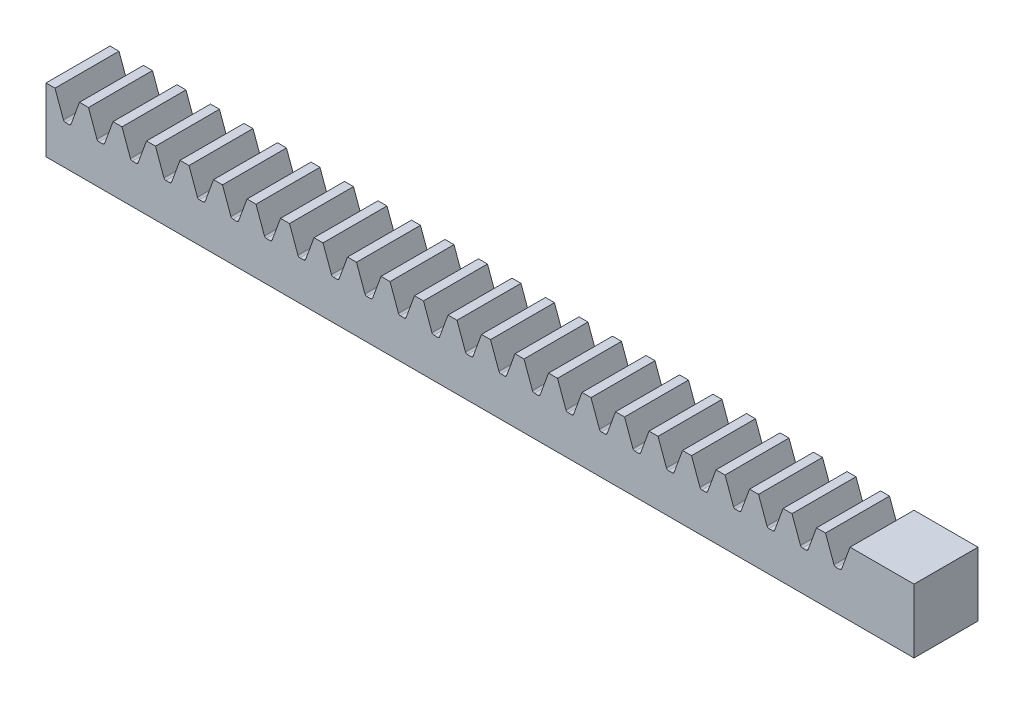
from build123d import *

# Parameters (mm, degrees)
BOSS_EXTRUDE1_DEPTH      = 152.4
BOSS_EXTRUDE1_DEPTH_BACK = 152.4
SKETCH3_W                = 3.175
SKETCH3_H                = 3.175
CUT_EXTRUDE1_DEPTH       = 153.416535561
FILLET1_R                = 0.099598028
LPATTERN1_START          = -1.5875
LPATTERN1_DEPTH          = 3.175
SKETCH7_W                = 122.08256
SKETCH7_H                = 3.175
SKETCH7_W_2              = 139.64412
CUT_EXTRUDE2_DEPTH       = 153.44133554


# Read off the part's stored shape, not the designer's step: LPattern1
with BuildPart() as part:
    # Sketch3 → Boss-Extrude1 (new, two sides: drawn at the far end of the back side and taken through both)
    with BuildSketch(Plane(origin=(0, 0, 0), x_dir=(0, 0, -1), z_dir=(1, 0, 0)).offset(-BOSS_EXTRUDE1_DEPTH_BACK)):
        Rectangle(SKETCH3_W, SKETCH3_H)
    extrude(amount=BOSS_EXTRUDE1_DEPTH + BOSS_EXTRUDE1_DEPTH_BACK)

    # Sketch4 → Cut-Extrude1 (cut, symmetric)
    with BuildSketch(Plane.XY):
        Polygon((-151.953986831, 1.5875), (-151.511775129, 0.372533333), (-151.179781702, 0.372533333), (-150.73757, 1.5875), align=None)
    extrude(amount=CUT_EXTRUDE1_DEPTH, both=True, mode=Mode.SUBTRACT)

    # Fillet1
    fillet1_edges = [part.edges().sort_by_distance(p)[0] for p in [
        (-151.179781702, 0.372533333, 0),
        (-151.511775129, 0.372533333, 0),
    ]]
    fillet(fillet1_edges, radius=FILLET1_R)

    # LPattern1 outline → LPattern1 (cut)
    with BuildSketch(Plane.XY.offset(LPATTERN1_START)):
        with BuildLine():
            ThreePointArc((-149.873197371, 0.43806683), (-149.836732921, 0.390545433), (-149.779605839, 0.372533333))
            Line((-149.779605839, 0.372533333), (-149.587090992, 0.372533333))
            ThreePointArc((-149.587090992, 0.372533333), (-149.52996391, 0.390545433), (-149.49349946, 0.43806683))
            Line((-149.49349946, 0.43806683), (-149.07514, 1.5875))
            Line((-149.07514, 1.5875), (-150.291556831, 1.5875))
            Line((-150.291556831, 1.5875), (-149.873197371, 0.43806683))
        make_face()
        with BuildLine():
            Line((27.14244, 1.5875), (25.926023169, 1.5875))
            Line((25.926023169, 1.5875), (26.344382629, 0.43806683))
            ThreePointArc((26.344382629, 0.43806683), (26.380847079, 0.390545433), (26.437974161, 0.372533333))
            Line((26.437974161, 0.372533333), (26.630489008, 0.372533333))
            ThreePointArc((26.630489008, 0.372533333), (26.68761609, 0.390545433), (26.72408054, 0.43806683))
            Line((26.72408054, 0.43806683), (27.14244, 1.5875))
        make_face()
        with BuildLine():
            Line((25.48001, 1.5875), (24.263593169, 1.5875))
            Line((24.263593169, 1.5875), (24.681952629, 0.43806683))
            ThreePointArc((24.681952629, 0.43806683), (24.718417079, 0.390545433), (24.775544161, 0.372533333))
            Line((24.775544161, 0.372533333), (24.968059008, 0.372533333))
            ThreePointArc((24.968059008, 0.372533333), (25.02518609, 0.390545433), (25.06165054, 0.43806683))
            Line((25.06165054, 0.43806683), (25.48001, 1.5875))
        make_face()
        with BuildLine():
            Line((23.81758, 1.5875), (22.601163169, 1.5875))
            Line((22.601163169, 1.5875), (23.019522629, 0.43806683))
            ThreePointArc((23.019522629, 0.43806683), (23.055987079, 0.390545433), (23.113114161, 0.372533333))
            Line((23.113114161, 0.372533333), (23.305629008, 0.372533333))
            ThreePointArc((23.305629008, 0.372533333), (23.36275609, 0.390545433), (23.39922054, 0.43806683))
            Line((23.39922054, 0.43806683), (23.81758, 1.5875))
        make_face()
        with BuildLine():
            Line((22.15515, 1.5875), (20.938733169, 1.5875))
            Line((20.938733169, 1.5875), (21.357092629, 0.43806683))
            ThreePointArc((21.357092629, 0.43806683), (21.393557079, 0.390545433), (21.450684161, 0.372533333))
            Line((21.450684161, 0.372533333), (21.643199008, 0.372533333))
            ThreePointArc((21.643199008, 0.372533333), (21.70032609, 0.390545433), (21.73679054, 0.43806683))
            Line((21.73679054, 0.43806683), (22.15515, 1.5875))
        make_face()
        with BuildLine():
            Line((20.49272, 1.5875), (19.276303169, 1.5875))
            Line((19.276303169, 1.5875), (19.694662629, 0.43806683))
            ThreePointArc((19.694662629, 0.43806683), (19.731127079, 0.390545433), (19.788254161, 0.372533333))
            Line((19.788254161, 0.372533333), (19.980769008, 0.372533333))
            ThreePointArc((19.980769008, 0.372533333), (20.03789609, 0.390545433), (20.07436054, 0.43806683))
            Line((20.07436054, 0.43806683), (20.49272, 1.5875))
        make_face()
        with BuildLine():
            Line((18.83029, 1.5875), (17.613873169, 1.5875))
            Line((17.613873169, 1.5875), (18.032232629, 0.43806683))
            ThreePointArc((18.032232629, 0.43806683), (18.068697079, 0.390545433), (18.125824161, 0.372533333))
            Line((18.125824161, 0.372533333), (18.318339008, 0.372533333))
            ThreePointArc((18.318339008, 0.372533333), (18.37546609, 0.390545433), (18.41193054, 0.43806683))
            Line((18.41193054, 0.43806683), (18.83029, 1.5875))
        make_face()
        with BuildLine():
            Line((17.16786, 1.5875), (15.951443169, 1.5875))
            Line((15.951443169, 1.5875), (16.369802629, 0.43806683))
            ThreePointArc((16.369802629, 0.43806683), (16.406267079, 0.390545433), (16.463394161, 0.372533333))
            Line((16.463394161, 0.372533333), (16.655909008, 0.372533333))
            ThreePointArc((16.655909008, 0.372533333), (16.71303609, 0.390545433), (16.74950054, 0.43806683))
            Line((16.74950054, 0.43806683), (17.16786, 1.5875))
        make_face()
        with BuildLine():
            Line((15.50543, 1.5875), (14.289013169, 1.5875))
            Line((14.289013169, 1.5875), (14.707372629, 0.43806683))
            ThreePointArc((14.707372629, 0.43806683), (14.743837079, 0.390545433), (14.800964161, 0.372533333))
            Line((14.800964161, 0.372533333), (14.993479008, 0.372533333))
            ThreePointArc((14.993479008, 0.372533333), (15.05060609, 0.390545433), (15.08707054, 0.43806683))
            Line((15.08707054, 0.43806683), (15.50543, 1.5875))
        make_face()
        with BuildLine():
            Line((13.843, 1.5875), (12.626583169, 1.5875))
            Line((12.626583169, 1.5875), (13.044942629, 0.43806683))
            ThreePointArc((13.044942629, 0.43806683), (13.081407079, 0.390545433), (13.138534161, 0.372533333))
            Line((13.138534161, 0.372533333), (13.331049008, 0.372533333))
            ThreePointArc((13.331049008, 0.372533333), (13.38817609, 0.390545433), (13.42464054, 0.43806683))
            Line((13.42464054, 0.43806683), (13.843, 1.5875))
        make_face()
        with BuildLine():
            Line((12.18057, 1.5875), (10.964153169, 1.5875))
            Line((10.964153169, 1.5875), (11.382512629, 0.43806683))
            ThreePointArc((11.382512629, 0.43806683), (11.418977079, 0.390545433), (11.476104161, 0.372533333))
            Line((11.476104161, 0.372533333), (11.668619008, 0.372533333))
            ThreePointArc((11.668619008, 0.372533333), (11.72574609, 0.390545433), (11.76221054, 0.43806683))
            Line((11.76221054, 0.43806683), (12.18057, 1.5875))
        make_face()
        with BuildLine():
            Line((10.51814, 1.5875), (9.301723169, 1.5875))
            Line((9.301723169, 1.5875), (9.720082629, 0.43806683))
            ThreePointArc((9.720082629, 0.43806683), (9.756547079, 0.390545433), (9.813674161, 0.372533333))
            Line((9.813674161, 0.372533333), (10.006189008, 0.372533333))
            ThreePointArc((10.006189008, 0.372533333), (10.06331609, 0.390545433), (10.09978054, 0.43806683))
            Line((10.09978054, 0.43806683), (10.51814, 1.5875))
        make_face()
        with BuildLine():
            Line((8.85571, 1.5875), (7.639293169, 1.5875))
            Line((7.639293169, 1.5875), (8.057652629, 0.43806683))
            ThreePointArc((8.057652629, 0.43806683), (8.094117079, 0.390545433), (8.151244161, 0.372533333))
            Line((8.151244161, 0.372533333), (8.343759008, 0.372533333))
            ThreePointArc((8.343759008, 0.372533333), (8.40088609, 0.390545433), (8.43735054, 0.43806683))
            Line((8.43735054, 0.43806683), (8.85571, 1.5875))
        make_face()
        with BuildLine():
            Line((7.19328, 1.5875), (5.976863169, 1.5875))
            Line((5.976863169, 1.5875), (6.395222629, 0.43806683))
            ThreePointArc((6.395222629, 0.43806683), (6.431687079, 0.390545433), (6.488814161, 0.372533333))
            Line((6.488814161, 0.372533333), (6.681329008, 0.372533333))
            ThreePointArc((6.681329008, 0.372533333), (6.73845609, 0.390545433), (6.77492054, 0.43806683))
            Line((6.77492054, 0.43806683), (7.19328, 1.5875))
        make_face()
        with BuildLine():
            Line((5.53085, 1.5875), (4.314433169, 1.5875))
            Line((4.314433169, 1.5875), (4.732792629, 0.43806683))
            ThreePointArc((4.732792629, 0.43806683), (4.769257079, 0.390545433), (4.826384161, 0.372533333))
            Line((4.826384161, 0.372533333), (5.018899008, 0.372533333))
            ThreePointArc((5.018899008, 0.372533333), (5.07602609, 0.390545433), (5.11249054, 0.43806683))
            Line((5.11249054, 0.43806683), (5.53085, 1.5875))
        make_face()
        with BuildLine():
            Line((3.86842, 1.5875), (2.652003169, 1.5875))
            Line((2.652003169, 1.5875), (3.070362629, 0.43806683))
            ThreePointArc((3.070362629, 0.43806683), (3.106827079, 0.390545433), (3.163954161, 0.372533333))
            Line((3.163954161, 0.372533333), (3.356469008, 0.372533333))
            ThreePointArc((3.356469008, 0.372533333), (3.41359609, 0.390545433), (3.45006054, 0.43806683))
            Line((3.45006054, 0.43806683), (3.86842, 1.5875))
        make_face()
        with BuildLine():
            Line((2.20599, 1.5875), (0.989573169, 1.5875))
            Line((0.989573169, 1.5875), (1.407932629, 0.43806683))
            ThreePointArc((1.407932629, 0.43806683), (1.444397079, 0.390545433), (1.501524161, 0.372533333))
            Line((1.501524161, 0.372533333), (1.694039008, 0.372533333))
            ThreePointArc((1.694039008, 0.372533333), (1.75116609, 0.390545433), (1.78763054, 0.43806683))
            Line((1.78763054, 0.43806683), (2.20599, 1.5875))
        make_face()
        with BuildLine():
            Line((0.54356, 1.5875), (-0.672856831, 1.5875))
            Line((-0.672856831, 1.5875), (-0.254497371, 0.43806683))
            ThreePointArc((-0.254497371, 0.43806683), (-0.218032921, 0.390545433), (-0.160905839, 0.372533333))
            Line((-0.160905839, 0.372533333), (0.031609008, 0.372533333))
            ThreePointArc((0.031609008, 0.372533333), (0.08873609, 0.390545433), (0.12520054, 0.43806683))
            Line((0.12520054, 0.43806683), (0.54356, 1.5875))
        make_face()
        with BuildLine():
            Line((-1.11887, 1.5875), (-2.335286831, 1.5875))
            Line((-2.335286831, 1.5875), (-1.916927371, 0.43806683))
            ThreePointArc((-1.916927371, 0.43806683), (-1.880462921, 0.390545433), (-1.823335839, 0.372533333))
            Line((-1.823335839, 0.372533333), (-1.630820992, 0.372533333))
            ThreePointArc((-1.630820992, 0.372533333), (-1.57369391, 0.390545433), (-1.53722946, 0.43806683))
            Line((-1.53722946, 0.43806683), (-1.11887, 1.5875))
        make_face()
        with BuildLine():
            Line((-2.7813, 1.5875), (-3.997716831, 1.5875))
            Line((-3.997716831, 1.5875), (-3.579357371, 0.43806683))
            ThreePointArc((-3.579357371, 0.43806683), (-3.542892921, 0.390545433), (-3.485765839, 0.372533333))
            Line((-3.485765839, 0.372533333), (-3.293250992, 0.372533333))
            ThreePointArc((-3.293250992, 0.372533333), (-3.23612391, 0.390545433), (-3.19965946, 0.43806683))
            Line((-3.19965946, 0.43806683), (-2.7813, 1.5875))
        make_face()
        with BuildLine():
            Line((-4.44373, 1.5875), (-5.660146831, 1.5875))
            Line((-5.660146831, 1.5875), (-5.241787371, 0.43806683))
            ThreePointArc((-5.241787371, 0.43806683), (-5.205322921, 0.390545433), (-5.148195839, 0.372533333))
            Line((-5.148195839, 0.372533333), (-4.955680992, 0.372533333))
            ThreePointArc((-4.955680992, 0.372533333), (-4.89855391, 0.390545433), (-4.86208946, 0.43806683))
            Line((-4.86208946, 0.43806683), (-4.44373, 1.5875))
        make_face()
        with BuildLine():
            Line((-6.10616, 1.5875), (-7.322576831, 1.5875))
            Line((-7.322576831, 1.5875), (-6.904217371, 0.43806683))
            ThreePointArc((-6.904217371, 0.43806683), (-6.867752921, 0.390545433), (-6.810625839, 0.372533333))
            Line((-6.810625839, 0.372533333), (-6.618110992, 0.372533333))
            ThreePointArc((-6.618110992, 0.372533333), (-6.56098391, 0.390545433), (-6.52451946, 0.43806683))
            Line((-6.52451946, 0.43806683), (-6.10616, 1.5875))
        make_face()
        with BuildLine():
            Line((-7.76859, 1.5875), (-8.985006831, 1.5875))
            Line((-8.985006831, 1.5875), (-8.566647371, 0.43806683))
            ThreePointArc((-8.566647371, 0.43806683), (-8.530182921, 0.390545433), (-8.473055839, 0.372533333))
            Line((-8.473055839, 0.372533333), (-8.280540992, 0.372533333))
            ThreePointArc((-8.280540992, 0.372533333), (-8.22341391, 0.390545433), (-8.18694946, 0.43806683))
            Line((-8.18694946, 0.43806683), (-7.76859, 1.5875))
        make_face()
        with BuildLine():
            Line((-9.43102, 1.5875), (-10.647436831, 1.5875))
            Line((-10.647436831, 1.5875), (-10.229077371, 0.43806683))
            ThreePointArc((-10.229077371, 0.43806683), (-10.192612921, 0.390545433), (-10.135485839, 0.372533333))
            Line((-10.135485839, 0.372533333), (-9.942970992, 0.372533333))
            ThreePointArc((-9.942970992, 0.372533333), (-9.88584391, 0.390545433), (-9.84937946, 0.43806683))
            Line((-9.84937946, 0.43806683), (-9.43102, 1.5875))
        make_face()
        with BuildLine():
            Line((-11.09345, 1.5875), (-12.309866831, 1.5875))
            Line((-12.309866831, 1.5875), (-11.891507371, 0.43806683))
            ThreePointArc((-11.891507371, 0.43806683), (-11.855042921, 0.390545433), (-11.797915839, 0.372533333))
            Line((-11.797915839, 0.372533333), (-11.605400992, 0.372533333))
            ThreePointArc((-11.605400992, 0.372533333), (-11.54827391, 0.390545433), (-11.51180946, 0.43806683))
            Line((-11.51180946, 0.43806683), (-11.09345, 1.5875))
        make_face()
        with BuildLine():
            Line((-12.75588, 1.5875), (-13.972296831, 1.5875))
            Line((-13.972296831, 1.5875), (-13.553937371, 0.43806683))
            ThreePointArc((-13.553937371, 0.43806683), (-13.517472921, 0.390545433), (-13.460345839, 0.372533333))
            Line((-13.460345839, 0.372533333), (-13.267830992, 0.372533333))
            ThreePointArc((-13.267830992, 0.372533333), (-13.21070391, 0.390545433), (-13.17423946, 0.43806683))
            Line((-13.17423946, 0.43806683), (-12.75588, 1.5875))
        make_face()
        with BuildLine():
            Line((-14.41831, 1.5875), (-15.634726831, 1.5875))
            Line((-15.634726831, 1.5875), (-15.216367371, 0.43806683))
            ThreePointArc((-15.216367371, 0.43806683), (-15.179902921, 0.390545433), (-15.122775839, 0.372533333))
            Line((-15.122775839, 0.372533333), (-14.930260992, 0.372533333))
            ThreePointArc((-14.930260992, 0.372533333), (-14.87313391, 0.390545433), (-14.83666946, 0.43806683))
            Line((-14.83666946, 0.43806683), (-14.41831, 1.5875))
        make_face()
        with BuildLine():
            Line((-16.08074, 1.5875), (-17.297156831, 1.5875))
            Line((-17.297156831, 1.5875), (-16.878797371, 0.43806683))
            ThreePointArc((-16.878797371, 0.43806683), (-16.842332921, 0.390545433), (-16.785205839, 0.372533333))
            Line((-16.785205839, 0.372533333), (-16.592690992, 0.372533333))
            ThreePointArc((-16.592690992, 0.372533333), (-16.53556391, 0.390545433), (-16.49909946, 0.43806683))
            Line((-16.49909946, 0.43806683), (-16.08074, 1.5875))
        make_face()
        with BuildLine():
            Line((-17.74317, 1.5875), (-18.959586831, 1.5875))
            Line((-18.959586831, 1.5875), (-18.541227371, 0.43806683))
            ThreePointArc((-18.541227371, 0.43806683), (-18.504762921, 0.390545433), (-18.447635839, 0.372533333))
            Line((-18.447635839, 0.372533333), (-18.255120992, 0.372533333))
            ThreePointArc((-18.255120992, 0.372533333), (-18.19799391, 0.390545433), (-18.16152946, 0.43806683))
            Line((-18.16152946, 0.43806683), (-17.74317, 1.5875))
        make_face()
        with BuildLine():
            Line((-19.4056, 1.5875), (-20.622016831, 1.5875))
            Line((-20.622016831, 1.5875), (-20.203657371, 0.43806683))
            ThreePointArc((-20.203657371, 0.43806683), (-20.167192921, 0.390545433), (-20.110065839, 0.372533333))
            Line((-20.110065839, 0.372533333), (-19.917550992, 0.372533333))
            ThreePointArc((-19.917550992, 0.372533333), (-19.86042391, 0.390545433), (-19.82395946, 0.43806683))
            Line((-19.82395946, 0.43806683), (-19.4056, 1.5875))
        make_face()
        with BuildLine():
            Line((-21.06803, 1.5875), (-22.284446831, 1.5875))
            Line((-22.284446831, 1.5875), (-21.866087371, 0.43806683))
            ThreePointArc((-21.866087371, 0.43806683), (-21.829622921, 0.390545433), (-21.772495839, 0.372533333))
            Line((-21.772495839, 0.372533333), (-21.579980992, 0.372533333))
            ThreePointArc((-21.579980992, 0.372533333), (-21.52285391, 0.390545433), (-21.48638946, 0.43806683))
            Line((-21.48638946, 0.43806683), (-21.06803, 1.5875))
        make_face()
        with BuildLine():
            Line((-22.73046, 1.5875), (-23.946876831, 1.5875))
            Line((-23.946876831, 1.5875), (-23.528517371, 0.43806683))
            ThreePointArc((-23.528517371, 0.43806683), (-23.492052921, 0.390545433), (-23.434925839, 0.372533333))
            Line((-23.434925839, 0.372533333), (-23.242410992, 0.372533333))
            ThreePointArc((-23.242410992, 0.372533333), (-23.18528391, 0.390545433), (-23.14881946, 0.43806683))
            Line((-23.14881946, 0.43806683), (-22.73046, 1.5875))
        make_face()
        with BuildLine():
            Line((-24.39289, 1.5875), (-25.609306831, 1.5875))
            Line((-25.609306831, 1.5875), (-25.190947371, 0.43806683))
            ThreePointArc((-25.190947371, 0.43806683), (-25.154482921, 0.390545433), (-25.097355839, 0.372533333))
            Line((-25.097355839, 0.372533333), (-24.904840992, 0.372533333))
            ThreePointArc((-24.904840992, 0.372533333), (-24.84771391, 0.390545433), (-24.81124946, 0.43806683))
            Line((-24.81124946, 0.43806683), (-24.39289, 1.5875))
        make_face()
        with BuildLine():
            Line((-26.05532, 1.5875), (-27.271736831, 1.5875))
            Line((-27.271736831, 1.5875), (-26.853377371, 0.43806683))
            ThreePointArc((-26.853377371, 0.43806683), (-26.816912921, 0.390545433), (-26.759785839, 0.372533333))
            Line((-26.759785839, 0.372533333), (-26.567270992, 0.372533333))
            ThreePointArc((-26.567270992, 0.372533333), (-26.51014391, 0.390545433), (-26.47367946, 0.43806683))
            Line((-26.47367946, 0.43806683), (-26.05532, 1.5875))
        make_face()
        with BuildLine():
            Line((-27.71775, 1.5875), (-28.934166831, 1.5875))
            Line((-28.934166831, 1.5875), (-28.515807371, 0.43806683))
            ThreePointArc((-28.515807371, 0.43806683), (-28.479342921, 0.390545433), (-28.422215839, 0.372533333))
            Line((-28.422215839, 0.372533333), (-28.229700992, 0.372533333))
            ThreePointArc((-28.229700992, 0.372533333), (-28.17257391, 0.390545433), (-28.13610946, 0.43806683))
            Line((-28.13610946, 0.43806683), (-27.71775, 1.5875))
        make_face()
        with BuildLine():
            Line((-29.38018, 1.5875), (-30.596596831, 1.5875))
            Line((-30.596596831, 1.5875), (-30.178237371, 0.43806683))
            ThreePointArc((-30.178237371, 0.43806683), (-30.141772921, 0.390545433), (-30.084645839, 0.372533333))
            Line((-30.084645839, 0.372533333), (-29.892130992, 0.372533333))
            ThreePointArc((-29.892130992, 0.372533333), (-29.83500391, 0.390545433), (-29.79853946, 0.43806683))
            Line((-29.79853946, 0.43806683), (-29.38018, 1.5875))
        make_face()
        with BuildLine():
            Line((-31.04261, 1.5875), (-32.259026831, 1.5875))
            Line((-32.259026831, 1.5875), (-31.840667371, 0.43806683))
            ThreePointArc((-31.840667371, 0.43806683), (-31.804202921, 0.390545433), (-31.747075839, 0.372533333))
            Line((-31.747075839, 0.372533333), (-31.554560992, 0.372533333))
            ThreePointArc((-31.554560992, 0.372533333), (-31.49743391, 0.390545433), (-31.46096946, 0.43806683))
            Line((-31.46096946, 0.43806683), (-31.04261, 1.5875))
        make_face()
        with BuildLine():
            Line((-32.70504, 1.5875), (-33.921456831, 1.5875))
            Line((-33.921456831, 1.5875), (-33.503097371, 0.43806683))
            ThreePointArc((-33.503097371, 0.43806683), (-33.466632921, 0.390545433), (-33.409505839, 0.372533333))
            Line((-33.409505839, 0.372533333), (-33.216990992, 0.372533333))
            ThreePointArc((-33.216990992, 0.372533333), (-33.15986391, 0.390545433), (-33.12339946, 0.43806683))
            Line((-33.12339946, 0.43806683), (-32.70504, 1.5875))
        make_face()
        with BuildLine():
            Line((-34.36747, 1.5875), (-35.583886831, 1.5875))
            Line((-35.583886831, 1.5875), (-35.165527371, 0.43806683))
            ThreePointArc((-35.165527371, 0.43806683), (-35.129062921, 0.390545433), (-35.071935839, 0.372533333))
            Line((-35.071935839, 0.372533333), (-34.879420992, 0.372533333))
            ThreePointArc((-34.879420992, 0.372533333), (-34.82229391, 0.390545433), (-34.78582946, 0.43806683))
            Line((-34.78582946, 0.43806683), (-34.36747, 1.5875))
        make_face()
        with BuildLine():
            Line((-36.0299, 1.5875), (-37.246316831, 1.5875))
            Line((-37.246316831, 1.5875), (-36.827957371, 0.43806683))
            ThreePointArc((-36.827957371, 0.43806683), (-36.791492921, 0.390545433), (-36.734365839, 0.372533333))
            Line((-36.734365839, 0.372533333), (-36.541850992, 0.372533333))
            ThreePointArc((-36.541850992, 0.372533333), (-36.48472391, 0.390545433), (-36.44825946, 0.43806683))
            Line((-36.44825946, 0.43806683), (-36.0299, 1.5875))
        make_face()
        with BuildLine():
            Line((-37.69233, 1.5875), (-38.908746831, 1.5875))
            Line((-38.908746831, 1.5875), (-38.490387371, 0.43806683))
            ThreePointArc((-38.490387371, 0.43806683), (-38.453922921, 0.390545433), (-38.396795839, 0.372533333))
            Line((-38.396795839, 0.372533333), (-38.204280992, 0.372533333))
            ThreePointArc((-38.204280992, 0.372533333), (-38.14715391, 0.390545433), (-38.11068946, 0.43806683))
            Line((-38.11068946, 0.43806683), (-37.69233, 1.5875))
        make_face()
        with BuildLine():
            Line((-39.35476, 1.5875), (-40.571176831, 1.5875))
            Line((-40.571176831, 1.5875), (-40.152817371, 0.43806683))
            ThreePointArc((-40.152817371, 0.43806683), (-40.116352921, 0.390545433), (-40.059225839, 0.372533333))
            Line((-40.059225839, 0.372533333), (-39.866710992, 0.372533333))
            ThreePointArc((-39.866710992, 0.372533333), (-39.80958391, 0.390545433), (-39.77311946, 0.43806683))
            Line((-39.77311946, 0.43806683), (-39.35476, 1.5875))
        make_face()
        with BuildLine():
            Line((-41.01719, 1.5875), (-42.233606831, 1.5875))
            Line((-42.233606831, 1.5875), (-41.815247371, 0.43806683))
            ThreePointArc((-41.815247371, 0.43806683), (-41.778782921, 0.390545433), (-41.721655839, 0.372533333))
            Line((-41.721655839, 0.372533333), (-41.529140992, 0.372533333))
            ThreePointArc((-41.529140992, 0.372533333), (-41.47201391, 0.390545433), (-41.43554946, 0.43806683))
            Line((-41.43554946, 0.43806683), (-41.01719, 1.5875))
        make_face()
        with BuildLine():
            Line((-42.67962, 1.5875), (-43.896036831, 1.5875))
            Line((-43.896036831, 1.5875), (-43.477677371, 0.43806683))
            ThreePointArc((-43.477677371, 0.43806683), (-43.441212921, 0.390545433), (-43.384085839, 0.372533333))
            Line((-43.384085839, 0.372533333), (-43.191570992, 0.372533333))
            ThreePointArc((-43.191570992, 0.372533333), (-43.13444391, 0.390545433), (-43.09797946, 0.43806683))
            Line((-43.09797946, 0.43806683), (-42.67962, 1.5875))
        make_face()
        with BuildLine():
            Line((-44.34205, 1.5875), (-45.558466831, 1.5875))
            Line((-45.558466831, 1.5875), (-45.140107371, 0.43806683))
            ThreePointArc((-45.140107371, 0.43806683), (-45.103642921, 0.390545433), (-45.046515839, 0.372533333))
            Line((-45.046515839, 0.372533333), (-44.854000992, 0.372533333))
            ThreePointArc((-44.854000992, 0.372533333), (-44.79687391, 0.390545433), (-44.76040946, 0.43806683))
            Line((-44.76040946, 0.43806683), (-44.34205, 1.5875))
        make_face()
        with BuildLine():
            Line((-46.00448, 1.5875), (-47.220896831, 1.5875))
            Line((-47.220896831, 1.5875), (-46.802537371, 0.43806683))
            ThreePointArc((-46.802537371, 0.43806683), (-46.766072921, 0.390545433), (-46.708945839, 0.372533333))
            Line((-46.708945839, 0.372533333), (-46.516430992, 0.372533333))
            ThreePointArc((-46.516430992, 0.372533333), (-46.45930391, 0.390545433), (-46.42283946, 0.43806683))
            Line((-46.42283946, 0.43806683), (-46.00448, 1.5875))
        make_face()
        with BuildLine():
            Line((-47.66691, 1.5875), (-48.883326831, 1.5875))
            Line((-48.883326831, 1.5875), (-48.464967371, 0.43806683))
            ThreePointArc((-48.464967371, 0.43806683), (-48.428502921, 0.390545433), (-48.371375839, 0.372533333))
            Line((-48.371375839, 0.372533333), (-48.178860992, 0.372533333))
            ThreePointArc((-48.178860992, 0.372533333), (-48.12173391, 0.390545433), (-48.08526946, 0.43806683))
            Line((-48.08526946, 0.43806683), (-47.66691, 1.5875))
        make_face()
        with BuildLine():
            Line((-49.32934, 1.5875), (-50.545756831, 1.5875))
            Line((-50.545756831, 1.5875), (-50.127397371, 0.43806683))
            ThreePointArc((-50.127397371, 0.43806683), (-50.090932921, 0.390545433), (-50.033805839, 0.372533333))
            Line((-50.033805839, 0.372533333), (-49.841290992, 0.372533333))
            ThreePointArc((-49.841290992, 0.372533333), (-49.78416391, 0.390545433), (-49.74769946, 0.43806683))
            Line((-49.74769946, 0.43806683), (-49.32934, 1.5875))
        make_face()
        with BuildLine():
            Line((-50.99177, 1.5875), (-52.208186831, 1.5875))
            Line((-52.208186831, 1.5875), (-51.789827371, 0.43806683))
            ThreePointArc((-51.789827371, 0.43806683), (-51.753362921, 0.390545433), (-51.696235839, 0.372533333))
            Line((-51.696235839, 0.372533333), (-51.503720992, 0.372533333))
            ThreePointArc((-51.503720992, 0.372533333), (-51.44659391, 0.390545433), (-51.41012946, 0.43806683))
            Line((-51.41012946, 0.43806683), (-50.99177, 1.5875))
        make_face()
        with BuildLine():
            Line((-52.6542, 1.5875), (-53.870616831, 1.5875))
            Line((-53.870616831, 1.5875), (-53.452257371, 0.43806683))
            ThreePointArc((-53.452257371, 0.43806683), (-53.415792921, 0.390545433), (-53.358665839, 0.372533333))
            Line((-53.358665839, 0.372533333), (-53.166150992, 0.372533333))
            ThreePointArc((-53.166150992, 0.372533333), (-53.10902391, 0.390545433), (-53.07255946, 0.43806683))
            Line((-53.07255946, 0.43806683), (-52.6542, 1.5875))
        make_face()
        with BuildLine():
            Line((-54.31663, 1.5875), (-55.533046831, 1.5875))
            Line((-55.533046831, 1.5875), (-55.114687371, 0.43806683))
            ThreePointArc((-55.114687371, 0.43806683), (-55.078222921, 0.390545433), (-55.021095839, 0.372533333))
            Line((-55.021095839, 0.372533333), (-54.828580992, 0.372533333))
            ThreePointArc((-54.828580992, 0.372533333), (-54.77145391, 0.390545433), (-54.73498946, 0.43806683))
            Line((-54.73498946, 0.43806683), (-54.31663, 1.5875))
        make_face()
        with BuildLine():
            Line((-55.97906, 1.5875), (-57.195476831, 1.5875))
            Line((-57.195476831, 1.5875), (-56.777117371, 0.43806683))
            ThreePointArc((-56.777117371, 0.43806683), (-56.740652921, 0.390545433), (-56.683525839, 0.372533333))
            Line((-56.683525839, 0.372533333), (-56.491010992, 0.372533333))
            ThreePointArc((-56.491010992, 0.372533333), (-56.43388391, 0.390545433), (-56.39741946, 0.43806683))
            Line((-56.39741946, 0.43806683), (-55.97906, 1.5875))
        make_face()
        with BuildLine():
            Line((-57.64149, 1.5875), (-58.857906831, 1.5875))
            Line((-58.857906831, 1.5875), (-58.439547371, 0.43806683))
            ThreePointArc((-58.439547371, 0.43806683), (-58.403082921, 0.390545433), (-58.345955839, 0.372533333))
            Line((-58.345955839, 0.372533333), (-58.153440992, 0.372533333))
            ThreePointArc((-58.153440992, 0.372533333), (-58.09631391, 0.390545433), (-58.05984946, 0.43806683))
            Line((-58.05984946, 0.43806683), (-57.64149, 1.5875))
        make_face()
        with BuildLine():
            Line((-59.30392, 1.5875), (-60.520336831, 1.5875))
            Line((-60.520336831, 1.5875), (-60.101977371, 0.43806683))
            ThreePointArc((-60.101977371, 0.43806683), (-60.065512921, 0.390545433), (-60.008385839, 0.372533333))
            Line((-60.008385839, 0.372533333), (-59.815870992, 0.372533333))
            ThreePointArc((-59.815870992, 0.372533333), (-59.75874391, 0.390545433), (-59.72227946, 0.43806683))
            Line((-59.72227946, 0.43806683), (-59.30392, 1.5875))
        make_face()
        with BuildLine():
            Line((-60.96635, 1.5875), (-62.182766831, 1.5875))
            Line((-62.182766831, 1.5875), (-61.764407371, 0.43806683))
            ThreePointArc((-61.764407371, 0.43806683), (-61.727942921, 0.390545433), (-61.670815839, 0.372533333))
            Line((-61.670815839, 0.372533333), (-61.478300992, 0.372533333))
            ThreePointArc((-61.478300992, 0.372533333), (-61.42117391, 0.390545433), (-61.38470946, 0.43806683))
            Line((-61.38470946, 0.43806683), (-60.96635, 1.5875))
        make_face()
        with BuildLine():
            Line((-62.62878, 1.5875), (-63.845196831, 1.5875))
            Line((-63.845196831, 1.5875), (-63.426837371, 0.43806683))
            ThreePointArc((-63.426837371, 0.43806683), (-63.390372921, 0.390545433), (-63.333245839, 0.372533333))
            Line((-63.333245839, 0.372533333), (-63.140730992, 0.372533333))
            ThreePointArc((-63.140730992, 0.372533333), (-63.08360391, 0.390545433), (-63.04713946, 0.43806683))
            Line((-63.04713946, 0.43806683), (-62.62878, 1.5875))
        make_face()
        with BuildLine():
            Line((-64.29121, 1.5875), (-65.507626831, 1.5875))
            Line((-65.507626831, 1.5875), (-65.089267371, 0.43806683))
            ThreePointArc((-65.089267371, 0.43806683), (-65.052802921, 0.390545433), (-64.995675839, 0.372533333))
            Line((-64.995675839, 0.372533333), (-64.803160992, 0.372533333))
            ThreePointArc((-64.803160992, 0.372533333), (-64.74603391, 0.390545433), (-64.70956946, 0.43806683))
            Line((-64.70956946, 0.43806683), (-64.29121, 1.5875))
        make_face()
        with BuildLine():
            Line((-65.95364, 1.5875), (-67.170056831, 1.5875))
            Line((-67.170056831, 1.5875), (-66.751697371, 0.43806683))
            ThreePointArc((-66.751697371, 0.43806683), (-66.715232921, 0.390545433), (-66.658105839, 0.372533333))
            Line((-66.658105839, 0.372533333), (-66.465590992, 0.372533333))
            ThreePointArc((-66.465590992, 0.372533333), (-66.40846391, 0.390545433), (-66.37199946, 0.43806683))
            Line((-66.37199946, 0.43806683), (-65.95364, 1.5875))
        make_face()
        with BuildLine():
            Line((-67.61607, 1.5875), (-68.832486831, 1.5875))
            Line((-68.832486831, 1.5875), (-68.414127371, 0.43806683))
            ThreePointArc((-68.414127371, 0.43806683), (-68.377662921, 0.390545433), (-68.320535839, 0.372533333))
            Line((-68.320535839, 0.372533333), (-68.128020992, 0.372533333))
            ThreePointArc((-68.128020992, 0.372533333), (-68.07089391, 0.390545433), (-68.03442946, 0.43806683))
            Line((-68.03442946, 0.43806683), (-67.61607, 1.5875))
        make_face()
        with BuildLine():
            Line((-69.2785, 1.5875), (-70.494916831, 1.5875))
            Line((-70.494916831, 1.5875), (-70.076557371, 0.43806683))
            ThreePointArc((-70.076557371, 0.43806683), (-70.040092921, 0.390545433), (-69.982965839, 0.372533333))
            Line((-69.982965839, 0.372533333), (-69.790450992, 0.372533333))
            ThreePointArc((-69.790450992, 0.372533333), (-69.73332391, 0.390545433), (-69.69685946, 0.43806683))
            Line((-69.69685946, 0.43806683), (-69.2785, 1.5875))
        make_face()
        with BuildLine():
            Line((-70.94093, 1.5875), (-72.157346831, 1.5875))
            Line((-72.157346831, 1.5875), (-71.738987371, 0.43806683))
            ThreePointArc((-71.738987371, 0.43806683), (-71.702522921, 0.390545433), (-71.645395839, 0.372533333))
            Line((-71.645395839, 0.372533333), (-71.452880992, 0.372533333))
            ThreePointArc((-71.452880992, 0.372533333), (-71.39575391, 0.390545433), (-71.35928946, 0.43806683))
            Line((-71.35928946, 0.43806683), (-70.94093, 1.5875))
        make_face()
        with BuildLine():
            Line((-72.60336, 1.5875), (-73.819776831, 1.5875))
            Line((-73.819776831, 1.5875), (-73.401417371, 0.43806683))
            ThreePointArc((-73.401417371, 0.43806683), (-73.364952921, 0.390545433), (-73.307825839, 0.372533333))
            Line((-73.307825839, 0.372533333), (-73.115310992, 0.372533333))
            ThreePointArc((-73.115310992, 0.372533333), (-73.05818391, 0.390545433), (-73.02171946, 0.43806683))
            Line((-73.02171946, 0.43806683), (-72.60336, 1.5875))
        make_face()
        with BuildLine():
            Line((-74.26579, 1.5875), (-75.482206831, 1.5875))
            Line((-75.482206831, 1.5875), (-75.063847371, 0.43806683))
            ThreePointArc((-75.063847371, 0.43806683), (-75.027382921, 0.390545433), (-74.970255839, 0.372533333))
            Line((-74.970255839, 0.372533333), (-74.777740992, 0.372533333))
            ThreePointArc((-74.777740992, 0.372533333), (-74.72061391, 0.390545433), (-74.68414946, 0.43806683))
            Line((-74.68414946, 0.43806683), (-74.26579, 1.5875))
        make_face()
        with BuildLine():
            Line((-75.92822, 1.5875), (-77.144636831, 1.5875))
            Line((-77.144636831, 1.5875), (-76.726277371, 0.43806683))
            ThreePointArc((-76.726277371, 0.43806683), (-76.689812921, 0.390545433), (-76.632685839, 0.372533333))
            Line((-76.632685839, 0.372533333), (-76.440170992, 0.372533333))
            ThreePointArc((-76.440170992, 0.372533333), (-76.38304391, 0.390545433), (-76.34657946, 0.43806683))
            Line((-76.34657946, 0.43806683), (-75.92822, 1.5875))
        make_face()
        with BuildLine():
            Line((-77.59065, 1.5875), (-78.807066831, 1.5875))
            Line((-78.807066831, 1.5875), (-78.388707371, 0.43806683))
            ThreePointArc((-78.388707371, 0.43806683), (-78.352242921, 0.390545433), (-78.295115839, 0.372533333))
            Line((-78.295115839, 0.372533333), (-78.102600992, 0.372533333))
            ThreePointArc((-78.102600992, 0.372533333), (-78.04547391, 0.390545433), (-78.00900946, 0.43806683))
            Line((-78.00900946, 0.43806683), (-77.59065, 1.5875))
        make_face()
        with BuildLine():
            Line((-79.25308, 1.5875), (-80.469496831, 1.5875))
            Line((-80.469496831, 1.5875), (-80.051137371, 0.43806683))
            ThreePointArc((-80.051137371, 0.43806683), (-80.014672921, 0.390545433), (-79.957545839, 0.372533333))
            Line((-79.957545839, 0.372533333), (-79.765030992, 0.372533333))
            ThreePointArc((-79.765030992, 0.372533333), (-79.70790391, 0.390545433), (-79.67143946, 0.43806683))
            Line((-79.67143946, 0.43806683), (-79.25308, 1.5875))
        make_face()
        with BuildLine():
            Line((-80.91551, 1.5875), (-82.131926831, 1.5875))
            Line((-82.131926831, 1.5875), (-81.713567371, 0.43806683))
            ThreePointArc((-81.713567371, 0.43806683), (-81.677102921, 0.390545433), (-81.619975839, 0.372533333))
            Line((-81.619975839, 0.372533333), (-81.427460992, 0.372533333))
            ThreePointArc((-81.427460992, 0.372533333), (-81.37033391, 0.390545433), (-81.33386946, 0.43806683))
            Line((-81.33386946, 0.43806683), (-80.91551, 1.5875))
        make_face()
        with BuildLine():
            Line((-82.57794, 1.5875), (-83.794356831, 1.5875))
            Line((-83.794356831, 1.5875), (-83.375997371, 0.43806683))
            ThreePointArc((-83.375997371, 0.43806683), (-83.339532921, 0.390545433), (-83.282405839, 0.372533333))
            Line((-83.282405839, 0.372533333), (-83.089890992, 0.372533333))
            ThreePointArc((-83.089890992, 0.372533333), (-83.03276391, 0.390545433), (-82.99629946, 0.43806683))
            Line((-82.99629946, 0.43806683), (-82.57794, 1.5875))
        make_face()
        with BuildLine():
            Line((-84.24037, 1.5875), (-85.456786831, 1.5875))
            Line((-85.456786831, 1.5875), (-85.038427371, 0.43806683))
            ThreePointArc((-85.038427371, 0.43806683), (-85.001962921, 0.390545433), (-84.944835839, 0.372533333))
            Line((-84.944835839, 0.372533333), (-84.752320992, 0.372533333))
            ThreePointArc((-84.752320992, 0.372533333), (-84.69519391, 0.390545433), (-84.65872946, 0.43806683))
            Line((-84.65872946, 0.43806683), (-84.24037, 1.5875))
        make_face()
        with BuildLine():
            Line((-85.9028, 1.5875), (-87.119216831, 1.5875))
            Line((-87.119216831, 1.5875), (-86.700857371, 0.43806683))
            ThreePointArc((-86.700857371, 0.43806683), (-86.664392921, 0.390545433), (-86.607265839, 0.372533333))
            Line((-86.607265839, 0.372533333), (-86.414750992, 0.372533333))
            ThreePointArc((-86.414750992, 0.372533333), (-86.35762391, 0.390545433), (-86.32115946, 0.43806683))
            Line((-86.32115946, 0.43806683), (-85.9028, 1.5875))
        make_face()
        with BuildLine():
            Line((-87.56523, 1.5875), (-88.781646831, 1.5875))
            Line((-88.781646831, 1.5875), (-88.363287371, 0.43806683))
            ThreePointArc((-88.363287371, 0.43806683), (-88.326822921, 0.390545433), (-88.269695839, 0.372533333))
            Line((-88.269695839, 0.372533333), (-88.077180992, 0.372533333))
            ThreePointArc((-88.077180992, 0.372533333), (-88.02005391, 0.390545433), (-87.98358946, 0.43806683))
            Line((-87.98358946, 0.43806683), (-87.56523, 1.5875))
        make_face()
        with BuildLine():
            Line((-89.22766, 1.5875), (-90.444076831, 1.5875))
            Line((-90.444076831, 1.5875), (-90.025717371, 0.43806683))
            ThreePointArc((-90.025717371, 0.43806683), (-89.989252921, 0.390545433), (-89.932125839, 0.372533333))
            Line((-89.932125839, 0.372533333), (-89.739610992, 0.372533333))
            ThreePointArc((-89.739610992, 0.372533333), (-89.68248391, 0.390545433), (-89.64601946, 0.43806683))
            Line((-89.64601946, 0.43806683), (-89.22766, 1.5875))
        make_face()
        with BuildLine():
            Line((-90.89009, 1.5875), (-92.106506831, 1.5875))
            Line((-92.106506831, 1.5875), (-91.688147371, 0.43806683))
            ThreePointArc((-91.688147371, 0.43806683), (-91.651682921, 0.390545433), (-91.594555839, 0.372533333))
            Line((-91.594555839, 0.372533333), (-91.402040992, 0.372533333))
            ThreePointArc((-91.402040992, 0.372533333), (-91.34491391, 0.390545433), (-91.30844946, 0.43806683))
            Line((-91.30844946, 0.43806683), (-90.89009, 1.5875))
        make_face()
        with BuildLine():
            Line((-92.55252, 1.5875), (-93.768936831, 1.5875))
            Line((-93.768936831, 1.5875), (-93.350577371, 0.43806683))
            ThreePointArc((-93.350577371, 0.43806683), (-93.314112921, 0.390545433), (-93.256985839, 0.372533333))
            Line((-93.256985839, 0.372533333), (-93.064470992, 0.372533333))
            ThreePointArc((-93.064470992, 0.372533333), (-93.00734391, 0.390545433), (-92.97087946, 0.43806683))
            Line((-92.97087946, 0.43806683), (-92.55252, 1.5875))
        make_face()
        with BuildLine():
            Line((-94.21495, 1.5875), (-95.431366831, 1.5875))
            Line((-95.431366831, 1.5875), (-95.013007371, 0.43806683))
            ThreePointArc((-95.013007371, 0.43806683), (-94.976542921, 0.390545433), (-94.919415839, 0.372533333))
            Line((-94.919415839, 0.372533333), (-94.726900992, 0.372533333))
            ThreePointArc((-94.726900992, 0.372533333), (-94.66977391, 0.390545433), (-94.63330946, 0.43806683))
            Line((-94.63330946, 0.43806683), (-94.21495, 1.5875))
        make_face()
        with BuildLine():
            Line((-95.87738, 1.5875), (-97.093796831, 1.5875))
            Line((-97.093796831, 1.5875), (-96.675437371, 0.43806683))
            ThreePointArc((-96.675437371, 0.43806683), (-96.638972921, 0.390545433), (-96.581845839, 0.372533333))
            Line((-96.581845839, 0.372533333), (-96.389330992, 0.372533333))
            ThreePointArc((-96.389330992, 0.372533333), (-96.33220391, 0.390545433), (-96.29573946, 0.43806683))
            Line((-96.29573946, 0.43806683), (-95.87738, 1.5875))
        make_face()
        with BuildLine():
            Line((-97.53981, 1.5875), (-98.756226831, 1.5875))
            Line((-98.756226831, 1.5875), (-98.337867371, 0.43806683))
            ThreePointArc((-98.337867371, 0.43806683), (-98.301402921, 0.390545433), (-98.244275839, 0.372533333))
            Line((-98.244275839, 0.372533333), (-98.051760992, 0.372533333))
            ThreePointArc((-98.051760992, 0.372533333), (-97.99463391, 0.390545433), (-97.95816946, 0.43806683))
            Line((-97.95816946, 0.43806683), (-97.53981, 1.5875))
        make_face()
        with BuildLine():
            Line((-99.20224, 1.5875), (-100.418656831, 1.5875))
            Line((-100.418656831, 1.5875), (-100.000297371, 0.43806683))
            ThreePointArc((-100.000297371, 0.43806683), (-99.963832921, 0.390545433), (-99.906705839, 0.372533333))
            Line((-99.906705839, 0.372533333), (-99.714190992, 0.372533333))
            ThreePointArc((-99.714190992, 0.372533333), (-99.65706391, 0.390545433), (-99.62059946, 0.43806683))
            Line((-99.62059946, 0.43806683), (-99.20224, 1.5875))
        make_face()
        with BuildLine():
            Line((-100.86467, 1.5875), (-102.081086831, 1.5875))
            Line((-102.081086831, 1.5875), (-101.662727371, 0.43806683))
            ThreePointArc((-101.662727371, 0.43806683), (-101.626262921, 0.390545433), (-101.569135839, 0.372533333))
            Line((-101.569135839, 0.372533333), (-101.376620992, 0.372533333))
            ThreePointArc((-101.376620992, 0.372533333), (-101.31949391, 0.390545433), (-101.28302946, 0.43806683))
            Line((-101.28302946, 0.43806683), (-100.86467, 1.5875))
        make_face()
        with BuildLine():
            Line((-102.5271, 1.5875), (-103.743516831, 1.5875))
            Line((-103.743516831, 1.5875), (-103.325157371, 0.43806683))
            ThreePointArc((-103.325157371, 0.43806683), (-103.288692921, 0.390545433), (-103.231565839, 0.372533333))
            Line((-103.231565839, 0.372533333), (-103.039050992, 0.372533333))
            ThreePointArc((-103.039050992, 0.372533333), (-102.98192391, 0.390545433), (-102.94545946, 0.43806683))
            Line((-102.94545946, 0.43806683), (-102.5271, 1.5875))
        make_face()
        with BuildLine():
            Line((-104.18953, 1.5875), (-105.405946831, 1.5875))
            Line((-105.405946831, 1.5875), (-104.987587371, 0.43806683))
            ThreePointArc((-104.987587371, 0.43806683), (-104.951122921, 0.390545433), (-104.893995839, 0.372533333))
            Line((-104.893995839, 0.372533333), (-104.701480992, 0.372533333))
            ThreePointArc((-104.701480992, 0.372533333), (-104.64435391, 0.390545433), (-104.60788946, 0.43806683))
            Line((-104.60788946, 0.43806683), (-104.18953, 1.5875))
        make_face()
        with BuildLine():
            Line((-105.85196, 1.5875), (-107.068376831, 1.5875))
            Line((-107.068376831, 1.5875), (-106.650017371, 0.43806683))
            ThreePointArc((-106.650017371, 0.43806683), (-106.613552921, 0.390545433), (-106.556425839, 0.372533333))
            Line((-106.556425839, 0.372533333), (-106.363910992, 0.372533333))
            ThreePointArc((-106.363910992, 0.372533333), (-106.30678391, 0.390545433), (-106.27031946, 0.43806683))
            Line((-106.27031946, 0.43806683), (-105.85196, 1.5875))
        make_face()
        with BuildLine():
            Line((-107.51439, 1.5875), (-108.730806831, 1.5875))
            Line((-108.730806831, 1.5875), (-108.312447371, 0.43806683))
            ThreePointArc((-108.312447371, 0.43806683), (-108.275982921, 0.390545433), (-108.218855839, 0.372533333))
            Line((-108.218855839, 0.372533333), (-108.026340992, 0.372533333))
            ThreePointArc((-108.026340992, 0.372533333), (-107.96921391, 0.390545433), (-107.93274946, 0.43806683))
            Line((-107.93274946, 0.43806683), (-107.51439, 1.5875))
        make_face()
        with BuildLine():
            Line((-109.17682, 1.5875), (-110.393236831, 1.5875))
            Line((-110.393236831, 1.5875), (-109.974877371, 0.43806683))
            ThreePointArc((-109.974877371, 0.43806683), (-109.938412921, 0.390545433), (-109.881285839, 0.372533333))
            Line((-109.881285839, 0.372533333), (-109.688770992, 0.372533333))
            ThreePointArc((-109.688770992, 0.372533333), (-109.63164391, 0.390545433), (-109.59517946, 0.43806683))
            Line((-109.59517946, 0.43806683), (-109.17682, 1.5875))
        make_face()
        with BuildLine():
            Line((-110.83925, 1.5875), (-112.055666831, 1.5875))
            Line((-112.055666831, 1.5875), (-111.637307371, 0.43806683))
            ThreePointArc((-111.637307371, 0.43806683), (-111.600842921, 0.390545433), (-111.543715839, 0.372533333))
            Line((-111.543715839, 0.372533333), (-111.351200992, 0.372533333))
            ThreePointArc((-111.351200992, 0.372533333), (-111.29407391, 0.390545433), (-111.25760946, 0.43806683))
            Line((-111.25760946, 0.43806683), (-110.83925, 1.5875))
        make_face()
        with BuildLine():
            Line((-112.50168, 1.5875), (-113.718096831, 1.5875))
            Line((-113.718096831, 1.5875), (-113.299737371, 0.43806683))
            ThreePointArc((-113.299737371, 0.43806683), (-113.263272921, 0.390545433), (-113.206145839, 0.372533333))
            Line((-113.206145839, 0.372533333), (-113.013630992, 0.372533333))
            ThreePointArc((-113.013630992, 0.372533333), (-112.95650391, 0.390545433), (-112.92003946, 0.43806683))
            Line((-112.92003946, 0.43806683), (-112.50168, 1.5875))
        make_face()
        with BuildLine():
            Line((-114.16411, 1.5875), (-115.380526831, 1.5875))
            Line((-115.380526831, 1.5875), (-114.962167371, 0.43806683))
            ThreePointArc((-114.962167371, 0.43806683), (-114.925702921, 0.390545433), (-114.868575839, 0.372533333))
            Line((-114.868575839, 0.372533333), (-114.676060992, 0.372533333))
            ThreePointArc((-114.676060992, 0.372533333), (-114.61893391, 0.390545433), (-114.58246946, 0.43806683))
            Line((-114.58246946, 0.43806683), (-114.16411, 1.5875))
        make_face()
        with BuildLine():
            Line((-115.82654, 1.5875), (-117.042956831, 1.5875))
            Line((-117.042956831, 1.5875), (-116.624597371, 0.43806683))
            ThreePointArc((-116.624597371, 0.43806683), (-116.588132921, 0.390545433), (-116.531005839, 0.372533333))
            Line((-116.531005839, 0.372533333), (-116.338490992, 0.372533333))
            ThreePointArc((-116.338490992, 0.372533333), (-116.28136391, 0.390545433), (-116.24489946, 0.43806683))
            Line((-116.24489946, 0.43806683), (-115.82654, 1.5875))
        make_face()
        with BuildLine():
            Line((-117.48897, 1.5875), (-118.705386831, 1.5875))
            Line((-118.705386831, 1.5875), (-118.287027371, 0.43806683))
            ThreePointArc((-118.287027371, 0.43806683), (-118.250562921, 0.390545433), (-118.193435839, 0.372533333))
            Line((-118.193435839, 0.372533333), (-118.000920992, 0.372533333))
            ThreePointArc((-118.000920992, 0.372533333), (-117.94379391, 0.390545433), (-117.90732946, 0.43806683))
            Line((-117.90732946, 0.43806683), (-117.48897, 1.5875))
        make_face()
        with BuildLine():
            Line((-119.1514, 1.5875), (-120.367816831, 1.5875))
            Line((-120.367816831, 1.5875), (-119.949457371, 0.43806683))
            ThreePointArc((-119.949457371, 0.43806683), (-119.912992921, 0.390545433), (-119.855865839, 0.372533333))
            Line((-119.855865839, 0.372533333), (-119.663350992, 0.372533333))
            ThreePointArc((-119.663350992, 0.372533333), (-119.60622391, 0.390545433), (-119.56975946, 0.43806683))
            Line((-119.56975946, 0.43806683), (-119.1514, 1.5875))
        make_face()
        with BuildLine():
            Line((-120.81383, 1.5875), (-122.030246831, 1.5875))
            Line((-122.030246831, 1.5875), (-121.611887371, 0.43806683))
            ThreePointArc((-121.611887371, 0.43806683), (-121.575422921, 0.390545433), (-121.518295839, 0.372533333))
            Line((-121.518295839, 0.372533333), (-121.325780992, 0.372533333))
            ThreePointArc((-121.325780992, 0.372533333), (-121.26865391, 0.390545433), (-121.23218946, 0.43806683))
            Line((-121.23218946, 0.43806683), (-120.81383, 1.5875))
        make_face()
        with BuildLine():
            Line((-122.47626, 1.5875), (-123.692676831, 1.5875))
            Line((-123.692676831, 1.5875), (-123.274317371, 0.43806683))
            ThreePointArc((-123.274317371, 0.43806683), (-123.237852921, 0.390545433), (-123.180725839, 0.372533333))
            Line((-123.180725839, 0.372533333), (-122.988210992, 0.372533333))
            ThreePointArc((-122.988210992, 0.372533333), (-122.93108391, 0.390545433), (-122.89461946, 0.43806683))
            Line((-122.89461946, 0.43806683), (-122.47626, 1.5875))
        make_face()
        with BuildLine():
            Line((-124.13869, 1.5875), (-125.355106831, 1.5875))
            Line((-125.355106831, 1.5875), (-124.936747371, 0.43806683))
            ThreePointArc((-124.936747371, 0.43806683), (-124.900282921, 0.390545433), (-124.843155839, 0.372533333))
            Line((-124.843155839, 0.372533333), (-124.650640992, 0.372533333))
            ThreePointArc((-124.650640992, 0.372533333), (-124.59351391, 0.390545433), (-124.55704946, 0.43806683))
            Line((-124.55704946, 0.43806683), (-124.13869, 1.5875))
        make_face()
        with BuildLine():
            Line((-125.80112, 1.5875), (-127.017536831, 1.5875))
            Line((-127.017536831, 1.5875), (-126.599177371, 0.43806683))
            ThreePointArc((-126.599177371, 0.43806683), (-126.562712921, 0.390545433), (-126.505585839, 0.372533333))
            Line((-126.505585839, 0.372533333), (-126.313070992, 0.372533333))
            ThreePointArc((-126.313070992, 0.372533333), (-126.25594391, 0.390545433), (-126.21947946, 0.43806683))
            Line((-126.21947946, 0.43806683), (-125.80112, 1.5875))
        make_face()
        with BuildLine():
            Line((-127.46355, 1.5875), (-128.679966831, 1.5875))
            Line((-128.679966831, 1.5875), (-128.261607371, 0.43806683))
            ThreePointArc((-128.261607371, 0.43806683), (-128.225142921, 0.390545433), (-128.168015839, 0.372533333))
            Line((-128.168015839, 0.372533333), (-127.975500992, 0.372533333))
            ThreePointArc((-127.975500992, 0.372533333), (-127.91837391, 0.390545433), (-127.88190946, 0.43806683))
            Line((-127.88190946, 0.43806683), (-127.46355, 1.5875))
        make_face()
        with BuildLine():
            Line((-129.12598, 1.5875), (-130.342396831, 1.5875))
            Line((-130.342396831, 1.5875), (-129.924037371, 0.43806683))
            ThreePointArc((-129.924037371, 0.43806683), (-129.887572921, 0.390545433), (-129.830445839, 0.372533333))
            Line((-129.830445839, 0.372533333), (-129.637930992, 0.372533333))
            ThreePointArc((-129.637930992, 0.372533333), (-129.58080391, 0.390545433), (-129.54433946, 0.43806683))
            Line((-129.54433946, 0.43806683), (-129.12598, 1.5875))
        make_face()
        with BuildLine():
            Line((-130.78841, 1.5875), (-132.004826831, 1.5875))
            Line((-132.004826831, 1.5875), (-131.586467371, 0.43806683))
            ThreePointArc((-131.586467371, 0.43806683), (-131.550002921, 0.390545433), (-131.492875839, 0.372533333))
            Line((-131.492875839, 0.372533333), (-131.300360992, 0.372533333))
            ThreePointArc((-131.300360992, 0.372533333), (-131.24323391, 0.390545433), (-131.20676946, 0.43806683))
            Line((-131.20676946, 0.43806683), (-130.78841, 1.5875))
        make_face()
        with BuildLine():
            Line((-132.45084, 1.5875), (-133.667256831, 1.5875))
            Line((-133.667256831, 1.5875), (-133.248897371, 0.43806683))
            ThreePointArc((-133.248897371, 0.43806683), (-133.212432921, 0.390545433), (-133.155305839, 0.372533333))
            Line((-133.155305839, 0.372533333), (-132.962790992, 0.372533333))
            ThreePointArc((-132.962790992, 0.372533333), (-132.90566391, 0.390545433), (-132.86919946, 0.43806683))
            Line((-132.86919946, 0.43806683), (-132.45084, 1.5875))
        make_face()
        with BuildLine():
            Line((-134.11327, 1.5875), (-135.329686831, 1.5875))
            Line((-135.329686831, 1.5875), (-134.911327371, 0.43806683))
            ThreePointArc((-134.911327371, 0.43806683), (-134.874862921, 0.390545433), (-134.817735839, 0.372533333))
            Line((-134.817735839, 0.372533333), (-134.625220992, 0.372533333))
            ThreePointArc((-134.625220992, 0.372533333), (-134.56809391, 0.390545433), (-134.53162946, 0.43806683))
            Line((-134.53162946, 0.43806683), (-134.11327, 1.5875))
        make_face()
        with BuildLine():
            Line((-135.7757, 1.5875), (-136.992116831, 1.5875))
            Line((-136.992116831, 1.5875), (-136.573757371, 0.43806683))
            ThreePointArc((-136.573757371, 0.43806683), (-136.537292921, 0.390545433), (-136.480165839, 0.372533333))
            Line((-136.480165839, 0.372533333), (-136.287650992, 0.372533333))
            ThreePointArc((-136.287650992, 0.372533333), (-136.23052391, 0.390545433), (-136.19405946, 0.43806683))
            Line((-136.19405946, 0.43806683), (-135.7757, 1.5875))
        make_face()
        with BuildLine():
            Line((-137.43813, 1.5875), (-138.654546831, 1.5875))
            Line((-138.654546831, 1.5875), (-138.236187371, 0.43806683))
            ThreePointArc((-138.236187371, 0.43806683), (-138.199722921, 0.390545433), (-138.142595839, 0.372533333))
            Line((-138.142595839, 0.372533333), (-137.950080992, 0.372533333))
            ThreePointArc((-137.950080992, 0.372533333), (-137.89295391, 0.390545433), (-137.85648946, 0.43806683))
            Line((-137.85648946, 0.43806683), (-137.43813, 1.5875))
        make_face()
        with BuildLine():
            Line((-139.10056, 1.5875), (-140.316976831, 1.5875))
            Line((-140.316976831, 1.5875), (-139.898617371, 0.43806683))
            ThreePointArc((-139.898617371, 0.43806683), (-139.862152921, 0.390545433), (-139.805025839, 0.372533333))
            Line((-139.805025839, 0.372533333), (-139.612510992, 0.372533333))
            ThreePointArc((-139.612510992, 0.372533333), (-139.55538391, 0.390545433), (-139.51891946, 0.43806683))
            Line((-139.51891946, 0.43806683), (-139.10056, 1.5875))
        make_face()
        with BuildLine():
            Line((-140.76299, 1.5875), (-141.979406831, 1.5875))
            Line((-141.979406831, 1.5875), (-141.561047371, 0.43806683))
            ThreePointArc((-141.561047371, 0.43806683), (-141.524582921, 0.390545433), (-141.467455839, 0.372533333))
            Line((-141.467455839, 0.372533333), (-141.274940992, 0.372533333))
            ThreePointArc((-141.274940992, 0.372533333), (-141.21781391, 0.390545433), (-141.18134946, 0.43806683))
            Line((-141.18134946, 0.43806683), (-140.76299, 1.5875))
        make_face()
        with BuildLine():
            Line((-142.42542, 1.5875), (-143.641836831, 1.5875))
            Line((-143.641836831, 1.5875), (-143.223477371, 0.43806683))
            ThreePointArc((-143.223477371, 0.43806683), (-143.187012921, 0.390545433), (-143.129885839, 0.372533333))
            Line((-143.129885839, 0.372533333), (-142.937370992, 0.372533333))
            ThreePointArc((-142.937370992, 0.372533333), (-142.88024391, 0.390545433), (-142.84377946, 0.43806683))
            Line((-142.84377946, 0.43806683), (-142.42542, 1.5875))
        make_face()
        with BuildLine():
            Line((-144.08785, 1.5875), (-145.304266831, 1.5875))
            Line((-145.304266831, 1.5875), (-144.885907371, 0.43806683))
            ThreePointArc((-144.885907371, 0.43806683), (-144.849442921, 0.390545433), (-144.792315839, 0.372533333))
            Line((-144.792315839, 0.372533333), (-144.599800992, 0.372533333))
            ThreePointArc((-144.599800992, 0.372533333), (-144.54267391, 0.390545433), (-144.50620946, 0.43806683))
            Line((-144.50620946, 0.43806683), (-144.08785, 1.5875))
        make_face()
        with BuildLine():
            Line((-145.75028, 1.5875), (-146.966696831, 1.5875))
            Line((-146.966696831, 1.5875), (-146.548337371, 0.43806683))
            ThreePointArc((-146.548337371, 0.43806683), (-146.511872921, 0.390545433), (-146.454745839, 0.372533333))
            Line((-146.454745839, 0.372533333), (-146.262230992, 0.372533333))
            ThreePointArc((-146.262230992, 0.372533333), (-146.20510391, 0.390545433), (-146.16863946, 0.43806683))
            Line((-146.16863946, 0.43806683), (-145.75028, 1.5875))
        make_face()
        with BuildLine():
            Line((-147.41271, 1.5875), (-148.629126831, 1.5875))
            Line((-148.629126831, 1.5875), (-148.210767371, 0.43806683))
            ThreePointArc((-148.210767371, 0.43806683), (-148.174302921, 0.390545433), (-148.117175839, 0.372533333))
            Line((-148.117175839, 0.372533333), (-147.924660992, 0.372533333))
            ThreePointArc((-147.924660992, 0.372533333), (-147.86753391, 0.390545433), (-147.83106946, 0.43806683))
            Line((-147.83106946, 0.43806683), (-147.41271, 1.5875))
        make_face()
    extrude(amount=LPATTERN1_DEPTH, mode=Mode.SUBTRACT)

    # Sketch7 → Cut-Extrude2 (cut, through all)
    with BuildSketch(Plane.XY.offset(1.5875)):
        with Locations((91.35872, 0)):
            Rectangle(SKETCH7_W, SKETCH7_H)
        with Locations((-82.57794, 0)):
            Rectangle(SKETCH7_W_2, SKETCH7_H)
    extrude(amount=-CUT_EXTRUDE2_DEPTH, mode=Mode.SUBTRACT)


solid = part.part
